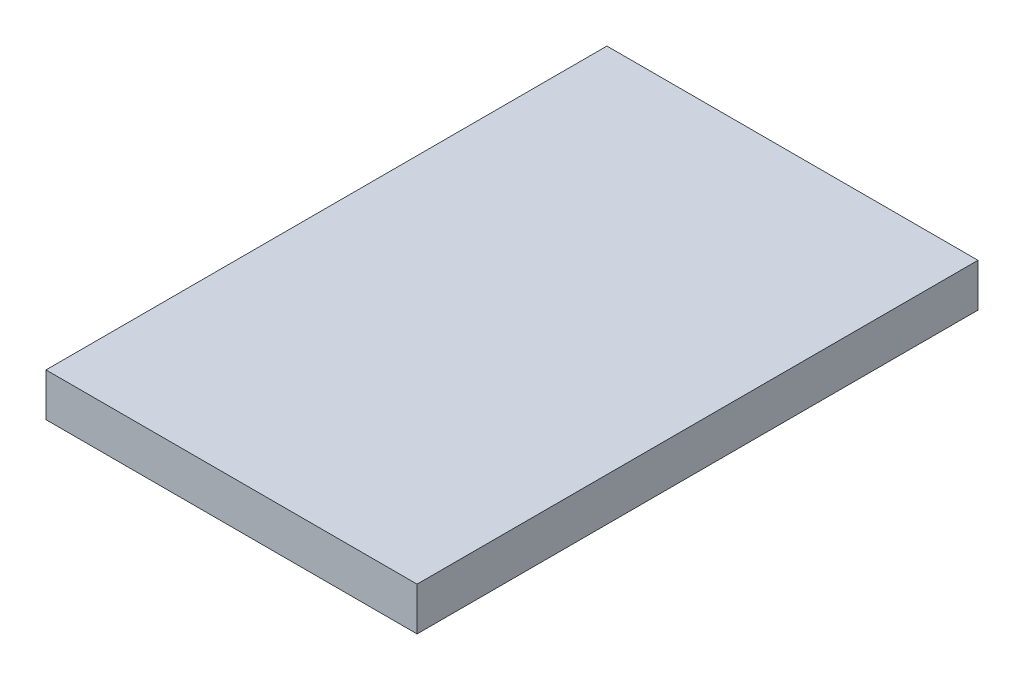
from build123d import *

# Parameters (mm, degrees)
SKETCH1_W           = 54.61
SKETCH1_H           = 82.55
BOSS_EXTRUDE1_DEPTH = 6.35


with BuildPart() as part:
    # Sketch1 → Boss-Extrude1 (new body)
    with BuildSketch(Plane(origin=(0, 0, 0), x_dir=(1, 0, 0), z_dir=(0, 1, 0))):
        with Locations((-27.305, 41.275)):
            Rectangle(SKETCH1_W, SKETCH1_H)
    extrude(amount=BOSS_EXTRUDE1_DEPTH)


solid = part.part
